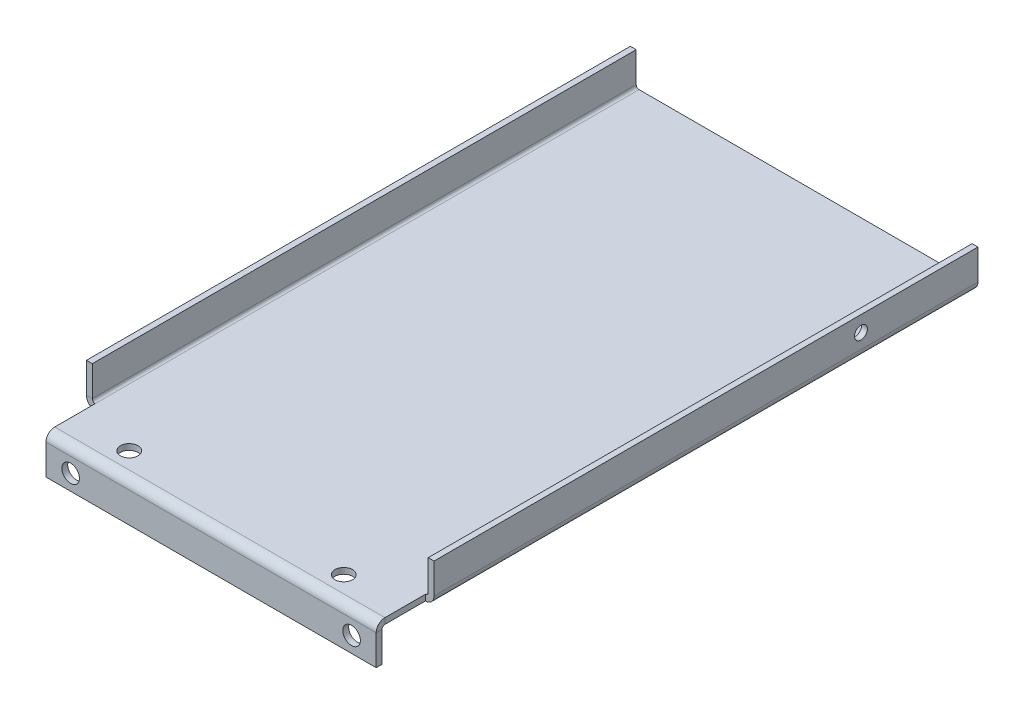
from build123d import *

# Parameters (mm, degrees)
SKETCH_2_W                       = 89.1
SKETCH_2_H                       = 1.5
SM_BASE_FLANGE_1_DEPTH           = 152
SM_EDGE_FLANGE_1_STRIP_W         = 7.4732
SM_EDGE_FLANGE_1_STRIP_H         = 1.5
SM_EDGE_FLANGE_1_STRIP_CUT_DEPTH = 152
SM_EDGE_FLANGE_1_DEPTH           = 152
SM_EDGE_FLANGE_2_STRIP_W         = 7.4732
SM_EDGE_FLANGE_2_STRIP_H         = 1.5
SM_EDGE_FLANGE_2_STRIP_CUT_DEPTH = 152
SM_EDGE_FLANGE_2_DEPTH           = 152
SKETCH_13_W                      = 16.114616681
SKETCH_13_H                      = 12.6
SKETCH_13_W_2                    = 14.895249376
CUT_EXTRUDE_1_DEPTH              = 177.473255764
SM_EDGE_FLANGE_3_STRIP_W         = 7.4732
SM_EDGE_FLANGE_3_STRIP_H         = 1.5
SM_EDGE_FLANGE_3_STRIP_CUT_DEPTH = 84.6268
SM_EDGE_FLANGE_3_DEPTH           = 84.6268
SKETCH_17_R                      = 2.25
CUT_EXTRUDE_2_DEPTH              = 10
SKETCH_18_R                      = 2.25
CUT_EXTRUDE_3_DEPTH              = 10
HOLE_WIZARD_M4_1_D               = 3.3
HOLE_WIZARD_M4_1_DEPTH           = 10.1
HOLE_WIZARD_M4_1_TIP             = 0.991420021


# Sheet-metal steps are written as plain solids
with BuildPart() as part:
    # Sketch 2 → 基体-法兰1 (new body)
    with BuildSketch(Plane.XY):
        with Locations((44.55, -0.75)):
            Rectangle(SKETCH_2_W, SKETCH_2_H)
    extrude(amount=SM_BASE_FLANGE_1_DEPTH)

    # 边线-法兰1 strip (across the edge) → 边线-法兰1 strip cut (cut)
    with BuildSketch(Plane.XY):
        with Locations((-1.5, -0.75)):
            Rectangle(SM_EDGE_FLANGE_1_STRIP_W, SM_EDGE_FLANGE_1_STRIP_H)
    extrude(amount=SM_EDGE_FLANGE_1_STRIP_CUT_DEPTH, mode=Mode.SUBTRACT)

    # 边线-法兰1 section (across the edge) → 边线-法兰1 (add)
    with BuildSketch(Plane.XY):
        with BuildLine():
            Line((0, 0.7366), (0, 8.5))
            Line((0, 8.5), (1.5, 8.5))
            Line((1.5, 8.5), (1.5, 0.7366))
            ThreePointArc((1.5, 0.7366), (1.715745145, 0.215745145), (2.2366, 0))
            Line((2.2366, 0), (2.2366, -1.5))
            ThreePointArc((2.2366, -1.5), (0.655084973, -0.844915027), (0, 0.7366))
        make_face()
    extrude(amount=SM_EDGE_FLANGE_1_DEPTH)

    # 边线-法兰2 strip (across the edge) → 边线-法兰2 strip cut (cut)
    with BuildSketch(Plane(origin=(89.1, 0, 152), x_dir=(-1, 0, 0), z_dir=(0, 0, -1))):
        with Locations((-1.5, -0.75)):
            Rectangle(SM_EDGE_FLANGE_2_STRIP_W, SM_EDGE_FLANGE_2_STRIP_H)
    extrude(amount=SM_EDGE_FLANGE_2_STRIP_CUT_DEPTH, mode=Mode.SUBTRACT)

    # 边线-法兰2 section (across the edge) → 边线-法兰2 (add)
    with BuildSketch(Plane(origin=(89.1, 0, 152), x_dir=(-1, 0, 0), z_dir=(0, 0, -1))):
        with BuildLine():
            Line((0, 0.7366), (0, 8.5))
            Line((0, 8.5), (1.5, 8.5))
            Line((1.5, 8.5), (1.5, 0.7366))
            ThreePointArc((1.5, 0.7366), (1.715745145, 0.215745145), (2.2366, 0))
            Line((2.2366, 0), (2.2366, -1.5))
            ThreePointArc((2.2366, -1.5), (0.655084973, -0.844915027), (0, 0.7366))
        make_face()
    extrude(amount=SM_EDGE_FLANGE_2_DEPTH)

    # 草图13 → 切除-拉伸1 (cut, through all)
    with BuildSketch(Plane.XZ.offset(1.5)):
        with Locations((-5.82070834, 145.7)):
            Rectangle(SKETCH_13_W, SKETCH_13_H)
        with Locations((94.311024688, 145.7)):
            Rectangle(SKETCH_13_W_2, SKETCH_13_H)
    extrude(amount=-CUT_EXTRUDE_1_DEPTH, mode=Mode.SUBTRACT)

    # 边线-法兰3 strip (across the edge) → 边线-法兰3 strip cut (cut)
    with BuildSketch(Plane(origin=(86.8634, -1.5, 152), x_dir=(0, 0, -1), z_dir=(-1, 0, 0))):
        with Locations((-1.5, -0.75)):
            Rectangle(SM_EDGE_FLANGE_3_STRIP_W, SM_EDGE_FLANGE_3_STRIP_H)
    extrude(amount=SM_EDGE_FLANGE_3_STRIP_CUT_DEPTH, mode=Mode.SUBTRACT)

    # 边线-法兰3 section (across the edge) → 边线-法兰3 (add)
    with BuildSketch(Plane(origin=(86.8634, -1.5, 152), x_dir=(0, 0, -1), z_dir=(-1, 0, 0))):
        with BuildLine():
            Line((0, 0.7366), (0, 8.5))
            Line((0, 8.5), (1.5, 8.5))
            Line((1.5, 8.5), (1.5, 0.7366))
            ThreePointArc((1.5, 0.7366), (1.715745145, 0.215745145), (2.2366, 0))
            Line((2.2366, 0), (2.2366, -1.5))
            ThreePointArc((2.2366, -1.5), (0.655084973, -0.844915027), (0, 0.7366))
        make_face()
    extrude(amount=SM_EDGE_FLANGE_3_DEPTH)

    # 草图17 → 切除-拉伸2 (cut)
    with BuildSketch(Plane.XY.offset(152)):
        with Locations((80.55, -6)):
            Circle(SKETCH_17_R)
        with Locations(Location((8.55, -6, 0), (0, 0, 270))):
            Circle(SKETCH_17_R)
    extrude(amount=-CUT_EXTRUDE_2_DEPTH, mode=Mode.SUBTRACT)

    # 草图18 → 切除-拉伸3 (cut)
    with BuildSketch(Plane.XZ.offset(1.5)):
        with Locations(Location((17.05, 145.5, 0), (0, 0, 270))):
            Circle(SKETCH_18_R)
        with Locations(Location((72.05, 145.5, 0), (0, 0, 90))):
            Circle(SKETCH_18_R)
    extrude(amount=-CUT_EXTRUDE_3_DEPTH, mode=Mode.SUBTRACT)

    # M4 螺纹孔1
    with Locations(Plane(origin=(89.1, 0, 0), x_dir=(0, 0, -1), z_dir=(1, 0, 0))):
        with Locations((-30, 4.5)):
            Hole(HOLE_WIZARD_M4_1_D / 2, depth=HOLE_WIZARD_M4_1_DEPTH)
            with Locations((0, 0, -(HOLE_WIZARD_M4_1_DEPTH + HOLE_WIZARD_M4_1_TIP / 2))):  # 118° drill point
                Cone(0, HOLE_WIZARD_M4_1_D / 2, HOLE_WIZARD_M4_1_TIP, mode=Mode.SUBTRACT)


solid = part.part
